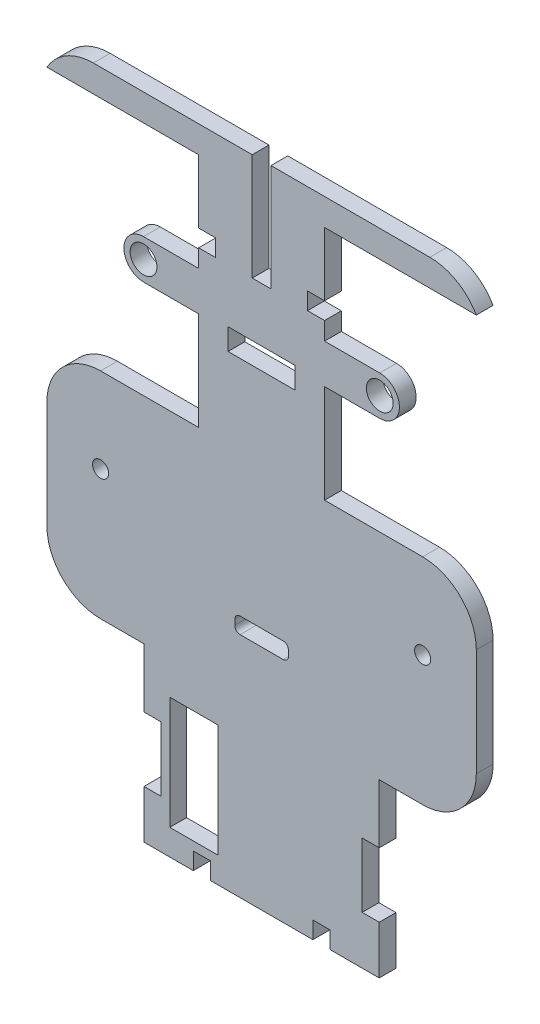
from build123d import *

# Parameters (mm, degrees)
SKETCH3_R           = 2.5
SKETCH3_R_2         = 1.5
BOSS_EXTRUDE1_DEPTH = 3.125
FILLET1_R           = 10
SKETCH4_W           = 12.5
SKETCH4_H           = 4
SKETCH4_W_2         = 9
SKETCH4_H_2         = 21
CUT_EXTRUDE2_DEPTH  = 73.594873269


with BuildPart() as part:
    # Sketch3 → Boss-Extrude1 (new body)
    with BuildSketch(Plane.XY):
        with BuildLine():
            Line((0, 23.314265754), (0, 40.6))
            Line((0, 40.6), (1.75, 40.6))
            Line((1.75, 40.6), (1.75, 60.5))
            Line((1.75, 60.5), (40, 60.5))
            Line((40, 60.5), (40, 55.5))
            Line((40, 55.5), (11.73, 55.5))
            Line((11.73, 55.5), (11.73, 43.67))
            Line((11.73, 43.67), (8.55, 43.67))
            Line((8.55, 43.67), (8.55, 40.49))
            Line((8.55, 40.49), (11.73, 40.49))
            Line((11.73, 40.49), (11.73, 37.16))
            Line((11.73, 37.16), (22, 37.16))
            ThreePointArc((22, 37.16), (25.665, 33.495), (22, 29.83))
            Line((22, 29.83), (11.73, 29.83))
            Line((11.73, 29.83), (11.73, 11.5))
            Line((11.73, 11.5), (40, 11.5))
            Line((40, 11.5), (40, -28.5))
            Line((40, -28.5), (21.91, -28.5))
            Line((21.91, -28.5), (21.91, -39.5))
            Line((21.91, -39.5), (18.73, -39.5))
            Line((18.73, -39.5), (18.73, -51.5))
            Line((18.73, -51.5), (21.91, -51.5))
            Line((21.91, -51.5), (21.91, -60.5))
            Line((21.91, -60.5), (12.73, -60.5))
            Line((12.73, -60.5), (12.73, -57.32))
            Line((12.73, -57.32), (9.55, -57.32))
            Line((9.55, -57.32), (9.55, -60.5))
            Line((9.55, -60.5), (0, -60.5))
            Line((0, -60.5), (0, 23.314265754))
        make_face()
        with Locations((22, 33.495)):
            Circle(SKETCH3_R, mode=Mode.SUBTRACT)
        with Locations((30, -4.33)):
            Circle(SKETCH3_R_2, mode=Mode.SUBTRACT)
    boss_extrude1 = extrude(amount=BOSS_EXTRUDE1_DEPTH)

    # Mirror1: Boss-Extrude1 across plane
    add(boss_extrude1.mirror(Plane(origin=(0, 23.314265754, 3.125), x_dir=(0, 0, 1), z_dir=(1, 0, 0))))

    # Fillet1
    # the kernel refuses this fillet: 10 mm, written as the material it takes off along each edge
    with BuildSketch(Plane(origin=(40, 60.5, -21.650635095), x_dir=(0, -1, 0), z_dir=(0, 0, 1))) as fillet1_piece_1:
        with BuildLine():
            CenterArc((10, -8.660254038), FILLET1_R, 120, 60)
            Line((0, -8.660254038), (-0.2, -8.660254038))
            Line((-0.2, -8.660254038), (-0.2, 0))
            Line((-0.2, 0), (0, 0.2))
            ThreePointArc((0, 0.2), (2.5, 0.2), (4.9, 0.173205081))
            Line((4.9, 0.173205081), (5, 0))
        make_face()
    extrude(amount=46.426270189, mode=Mode.SUBTRACT)
    with BuildSketch(Plane(origin=(40, 11.5, -25), x_dir=(0, -1, 0), z_dir=(0, 0, 1)), Plane(origin=(40, -28.5, -25), x_dir=(-1, 0, 0), z_dir=(0, 0, 1)), Plane(origin=(-40, 11.5, -25), x_dir=(1, 0, 0), z_dir=(0, 0, 1)), Plane(origin=(-40, -28.5, -25), x_dir=(0, 1, 0), z_dir=(0, 0, 1))) as fillet1_piece_2:
        with BuildLine():
            CenterArc((FILLET1_R, -FILLET1_R), FILLET1_R, 90, 90)
            Line((0, -FILLET1_R), (-FILLET1_R * 0.02, -FILLET1_R))
            Line((-FILLET1_R * 0.02, -FILLET1_R), (-FILLET1_R * 0.02, FILLET1_R * 0.02))
            Line((-FILLET1_R * 0.02, FILLET1_R * 0.02), (FILLET1_R, FILLET1_R * 0.02))
            Line((FILLET1_R, FILLET1_R * 0.02), (FILLET1_R, 0))
        make_face()
    extrude(amount=53.125, mode=Mode.SUBTRACT)
    with BuildSketch(Plane(origin=(-40, 60.5, -21.650635095), x_dir=(1, 0, 0), z_dir=(0, 0, 1))) as fillet1_piece_3:
        with BuildLine():
            CenterArc((8.660254038, -10), FILLET1_R, 90, 60)
            Line((0, -5), (-0.173205081, -4.9))
            ThreePointArc((-0.173205081, -4.9), (-0.2, -2.5), (-0.2, 0))
            Line((-0.2, 0), (0, 0.2))
            Line((0, 0.2), (8.660254038, 0.2))
            Line((8.660254038, 0.2), (8.660254038, 0))
        make_face()
    extrude(amount=46.426270189, mode=Mode.SUBTRACT)

    # Sketch4 → Cut-Extrude2 (cut, through all)
    with BuildSketch(Plane.XY.offset(3.125)):
        with Locations((0, 28.5)):
            Rectangle(SKETCH4_W, SKETCH4_H)
        with Locations((-12.61, -45.2)):
            Rectangle(SKETCH4_W_2, SKETCH4_H_2)
        with BuildLine():
            Line((-4, -15.06), (4, -15.06))
            ThreePointArc((4, -15.06), (4.707106781, -15.352893219), (5, -16.06))
            Line((5, -16.06), (5, -17.06))
            ThreePointArc((5, -17.06), (4.707106781, -17.767106781), (4, -18.06))
            Line((4, -18.06), (-4, -18.06))
            ThreePointArc((-4, -18.06), (-4.707106781, -17.767106781), (-5, -17.06))
            Line((-5, -17.06), (-5, -16.06))
            ThreePointArc((-5, -16.06), (-4.707106781, -15.352893219), (-4, -15.06))
        make_face()
    extrude(amount=-CUT_EXTRUDE2_DEPTH, mode=Mode.SUBTRACT)


solid = part.part
